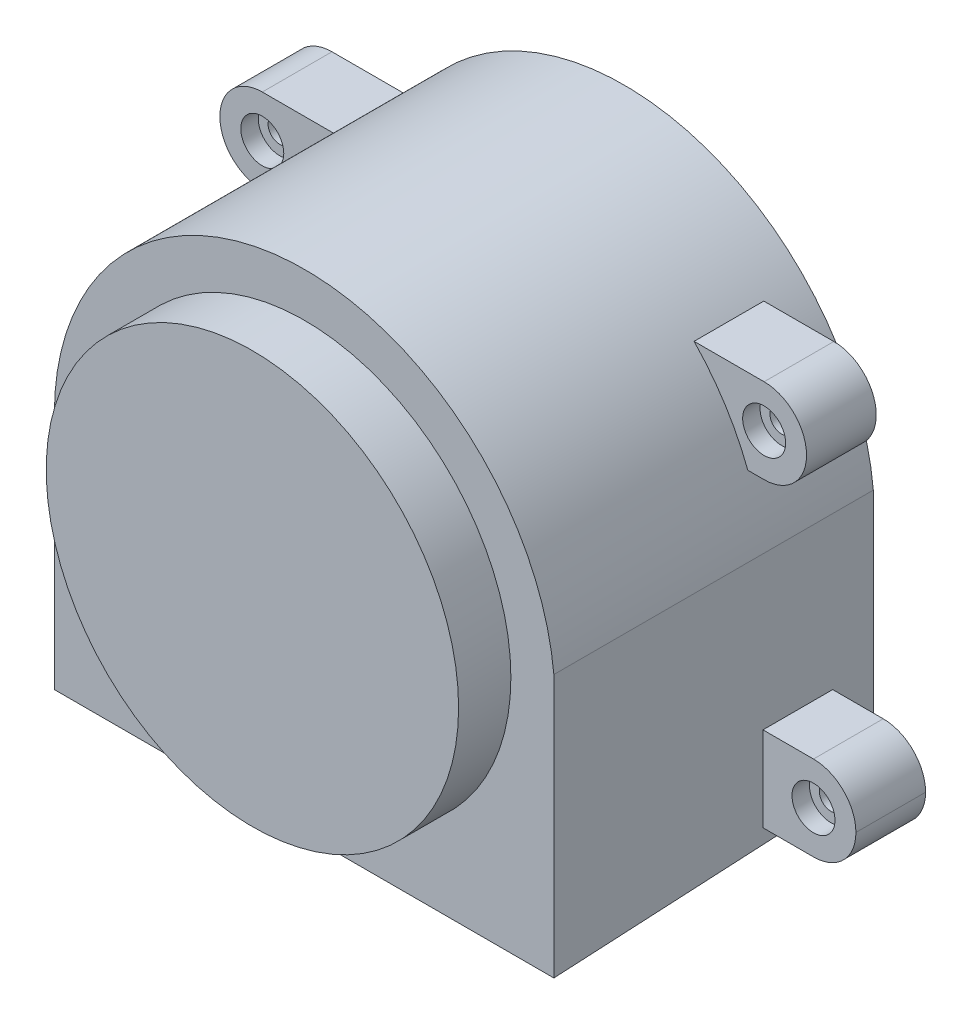
from build123d import *

# Parameters (mm, degrees)
EXTRUDE_1_DEPTH                  = 55
CUT_EXTRUDE_1_DEPTH              = 53
EXTRUDE_START                    = -7
SKETCH_3_W                       = 16
SKETCH_3_H                       = 14.6
EXTRUDE_2_DEPTH                  = 12
FILLET_1_R                       = 7.3
SKETCH_4_R                       = 2
CUT_EXTRUDE_2_DEPTH              = 12
SKETCH_5_R                       = 3.7
CUT_EXTRUDE_3_DEPTH              = 3
SKETCH_6_R                       = 5.3
CUT_EXTRUDE_4_DEPTH              = 7
EXTRUDE_START_2                  = -12
SKETCH_7_R                       = 2
EXTRUDE_3_DEPTH                  = 12
SKETCH_8_R                       = 3.7
CUT_EXTRUDE_5_DEPTH              = 3
SKETCH_9_R                       = 5.3
CUT_EXTRUDE_6_DEPTH              = 7
FILLET_1_OF_MIRROR_1_R           = 7.3
SKETCH_10_R                      = 35.5
EXTRUDE_4_DEPTH                  = 9
SKETCH_11_R                      = 14
EXTRUDE_5_DEPTH                  = 52
SKETCH_12_R                      = 14.5
EXTRUDE_6_DEPTH                  = 10
SKETCH_14_W                      = 2
SKETCH_14_H                      = 12
EXTRUDE_7_DEPTH                  = 10
FILLET_2_R                       = 5
CUT_EXTRUDE_7_DEPTH              = 10
PATTERN_CIRCULAR_1_COUNT         = 15
FILLET_2_OF_PATTERN_CIRCULAR_1_R = 5
DRAFT_4_ANGLE                    = -3


with BuildPart() as part:
    # 草图1 → 凸台-拉伸1 (new body)
    with BuildSketch(Plane.XY):
        with BuildLine():
            Line((0, 0), (86, 0))
            Line((86, 0), (86, 45.247288271))
            ThreePointArc((86, 45.247288271), (41.023946051, 84.149970964), (0, 41.1))
            Line((0, 41.1), (0, 0))
        make_face()
    extrude(amount=EXTRUDE_1_DEPTH)

    # 草图2 → 切除-拉伸1 (cut)
    with BuildSketch(Plane(origin=(0, 0, 0), x_dir=(-1, 0, 0), z_dir=(0, 0, -1))):
        with BuildLine():
            Line((-2, 0), (-2, 41.1))
            ThreePointArc((-2, 41.1), (-41.072686507, 82.149969549), (-84, 45.149691346))
            Line((-84, 45.149691346), (-84, 0))
            Line((-84, 0), (-2, 0))
        make_face()
    extrude(amount=-CUT_EXTRUDE_1_DEPTH, mode=Mode.SUBTRACT)

    # 草图3 → 凸台-拉伸2 (add)
    with BuildSketch(Plane(origin=(0, 0, 0), x_dir=(-1, 0, 0), z_dir=(0, 0, -1)).offset(EXTRUDE_START)):
        with Locations((8, 11.7)):
            Rectangle(SKETCH_3_W, SKETCH_3_H)
    extrude_2 = extrude(amount=-EXTRUDE_2_DEPTH)

    # 圆角1
    fillet_1_edges = [part.edges().sort_by_distance(p)[0] for p in [
        (-16, 19, 13),
        (-16, 4.4, 13),
    ]]
    fillet(fillet_1_edges, radius=FILLET_1_R - 0.0001)  # a hair under: the kernel refuses the full size

    # 草图4 → 切除-拉伸2 (cut)
    with BuildSketch(Plane.XY.offset(19)):
        with Locations((-8.7, 11.7)):
            Circle(SKETCH_4_R)
    cut_extrude_2 = extrude(amount=-CUT_EXTRUDE_2_DEPTH, mode=Mode.SUBTRACT)

    # 草图5 → 切除-拉伸3 (cut)
    with BuildSketch(Plane.XY.offset(19)):
        with Locations((-8.7, 11.7)):
            Circle(SKETCH_5_R)
    cut_extrude_3 = extrude(amount=-CUT_EXTRUDE_3_DEPTH, mode=Mode.SUBTRACT)

    # 草图6 → 切除-拉伸4 (cut)
    with BuildSketch(Plane(origin=(0, 0, 7), x_dir=(-1, 0, 0), z_dir=(0, 0, -1))):
        with Locations((8.7, 11.7)):
            Circle(SKETCH_6_R)
    cut_extrude_4 = extrude(amount=-CUT_EXTRUDE_4_DEPTH, mode=Mode.SUBTRACT)

    # 草图7 → 凸台-拉伸3 (add)
    with BuildSketch(Plane.XY.offset(19).offset(EXTRUDE_START_2)):
        with BuildLine():
            Line((-0.2, 71), (12.058092842, 71))
            ThreePointArc((12.058092842, 71), (6.693205908, 64.168492451), (2.807072581, 56.4))
            Line((2.807072581, 56.4), (-0.2, 56.4))
            ThreePointArc((-0.2, 56.4), (-7.5, 63.7), (-0.2, 71))
        make_face()
        with Locations((-0.2, 63.7)):
            Circle(SKETCH_7_R, mode=Mode.SUBTRACT)
    extrude_3 = extrude(amount=EXTRUDE_3_DEPTH)

    # 草图8 → 切除-拉伸5 (cut)
    with BuildSketch(Plane.XY.offset(19)):
        with Locations((-0.2, 63.7)):
            Circle(SKETCH_8_R)
    cut_extrude_5 = extrude(amount=-CUT_EXTRUDE_5_DEPTH, mode=Mode.SUBTRACT)

    # 草图9 → 切除-拉伸6 (cut)
    with BuildSketch(Plane(origin=(0, 0, 7), x_dir=(-1, 0, 0), z_dir=(0, 0, -1))):
        with Locations((0.2, 63.7)):
            Circle(SKETCH_9_R)
    cut_extrude_6 = extrude(amount=-CUT_EXTRUDE_6_DEPTH, mode=Mode.SUBTRACT)

    # 镜向1: 凸台-拉伸2, 切除-拉伸2, 切除-拉伸3, 切除-拉伸4, 凸台-拉伸3, 切除-拉伸5, 切除-拉伸6 across plane
    add(extrude_2.mirror(Plane.ZY.offset(-43)))
    add(cut_extrude_2.mirror(Plane.ZY.offset(-43)), mode=Mode.SUBTRACT)
    add(cut_extrude_3.mirror(Plane.ZY.offset(-43)), mode=Mode.SUBTRACT)
    add(cut_extrude_4.mirror(Plane.ZY.offset(-43)), mode=Mode.SUBTRACT)
    add(extrude_3.mirror(Plane.ZY.offset(-43)))
    add(cut_extrude_5.mirror(Plane.ZY.offset(-43)), mode=Mode.SUBTRACT)
    add(cut_extrude_6.mirror(Plane.ZY.offset(-43)), mode=Mode.SUBTRACT)

    # 圆角1 of 镜向1
    fillet_1_of_mirror_1_edges = [part.edges().sort_by_distance(p)[0] for p in [
        (102, 19, 13),
        (102, 4.4, 13),
    ]]
    fillet(fillet_1_of_mirror_1_edges, radius=FILLET_1_OF_MIRROR_1_R - 0.0001)  # a hair under: the kernel refuses the full size

    # 草图10 → 凸台-拉伸4 (add)
    with BuildSketch(Plane.XY.offset(55)):
        with Locations((43.1, 41.1)):
            Circle(SKETCH_10_R)
    extrude(amount=EXTRUDE_4_DEPTH)

    # 草图11 → 凸台-拉伸5 (add)
    with BuildSketch(Plane(origin=(0, 0, 53), x_dir=(-1, 0, 0), z_dir=(0, 0, -1))):
        with Locations(Location((-43.1, 41.1, 0), (0, 0, 180))):
            Circle(SKETCH_11_R)
    extrude(amount=EXTRUDE_5_DEPTH)

    # 草图12 → 凸台-拉伸6 (add)
    with BuildSketch(Plane(origin=(0, 0, 53), x_dir=(-1, 0, 0), z_dir=(0, 0, -1))):
        with Locations((-43.1, 41.1)):
            Circle(SKETCH_12_R)
    extrude(amount=EXTRUDE_6_DEPTH)

    # 草图14 → 凸台-拉伸7 (add)
    with BuildSketch(Plane(origin=(0, 0, 53), x_dir=(-1, 0, 0), z_dir=(0, 0, -1))):
        with Locations((-43.1, 61.565476141)):
            Rectangle(SKETCH_14_W, SKETCH_14_H)
    extrude_7 = extrude(amount=EXTRUDE_7_DEPTH)

    # 圆角2
    fillet_2_edges = [part.edges().sort_by_distance(p)[0] for p in [
        (43.1, 67.565476141, 43),
    ]]
    fillet(fillet_2_edges, radius=FILLET_2_R)

    # 草图15 → 切除-拉伸7 (cut)
    with BuildSketch(Plane.ZY.offset(-42.1)):
        with BuildLine():
            Line((51, 65.565476141), (48, 65.565476141))
            ThreePointArc((48, 65.565476141), (45.878679656, 64.686796485), (45, 62.565476141))
            Line((45, 62.565476141), (45, 57.565476141))
            Line((45, 57.565476141), (51, 57.565476141))
            Line((51, 57.565476141), (51, 65.565476141))
        make_face()
    cut_extrude_7 = extrude(amount=-CUT_EXTRUDE_7_DEPTH, mode=Mode.SUBTRACT)

    # 阵列(圆周)1: 凸台-拉伸7, 切除-拉伸7 ×15 about axis
    pattern_circular_1_axis = Axis((43.1, 41.1, 0), (0, 0, 1))
    add([extrude_7.rotate(pattern_circular_1_axis, i * 360 / PATTERN_CIRCULAR_1_COUNT) for i in range(1, PATTERN_CIRCULAR_1_COUNT)])
    add([cut_extrude_7.rotate(pattern_circular_1_axis, i * 360 / PATTERN_CIRCULAR_1_COUNT) for i in range(1, PATTERN_CIRCULAR_1_COUNT)], mode=Mode.SUBTRACT)

    # 圆角2 of 阵列(圆周)1
    fillet_2_of_pattern_circular_1_edges = [part.edges().sort_by_distance(p)[0] for p in [
        (32.335521077, 65.277415513, 43),
        (23.432318352, 58.808860098, 43),
        (17.929836459, 49.278281892, 43),
        (16.779504506, 38.333604449, 43),
        (20.180225338, 27.867261929, 43),
        (27.543983429, 19.688980037, 43),
        (37.597518107, 15.21285801, 43),
        (48.602481893, 15.21285801, 43),
        (58.656016571, 19.688980037, 43),
        (66.019774662, 27.867261929, 43),
        (69.420495494, 38.333604449, 43),
        (68.270163541, 49.278281892, 43),
        (62.767681648, 58.808860098, 43),
        (53.864478923, 65.277415513, 43),
    ]]
    fillet(fillet_2_of_pattern_circular_1_edges, radius=FILLET_2_OF_PATTERN_CIRCULAR_1_R)

    # 拔模4
    draft_4_faces = [part.faces().sort_by_distance(p)[0] for p in [
        (1, 0, 1.020832993),
    ]]
    draft(draft_4_faces, Plane(origin=(43.1, 41.1, 55), x_dir=(1, 0, 0), z_dir=(0, 0, 1)), DRAFT_4_ANGLE)


solid = part.part
